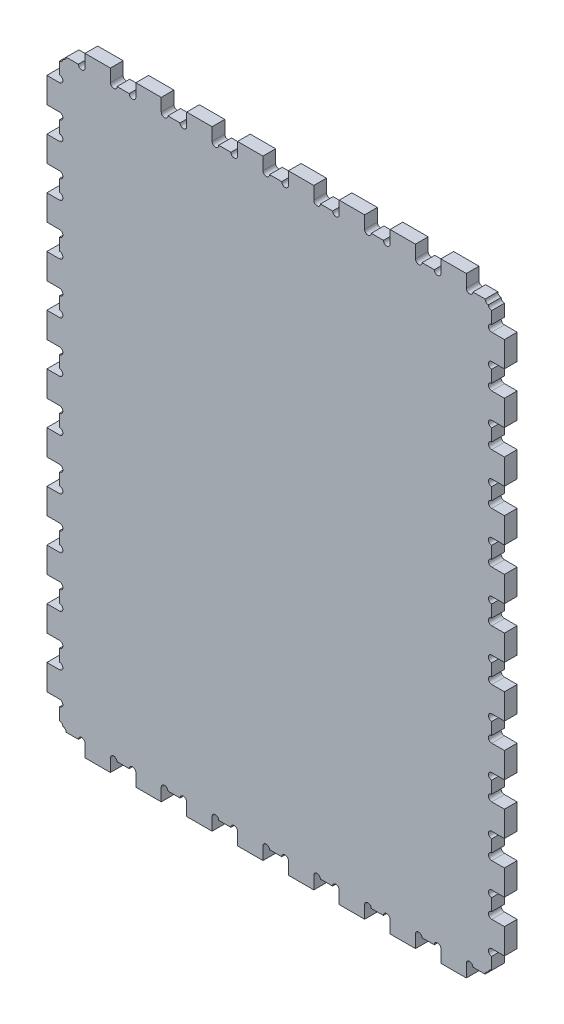
from build123d import *

# Parameters (mm, degrees)
SKETCH1_W               = 457.2
SKETCH1_H               = 609.6
BOSS_EXTRUDE1_DEPTH     = 12.7
CUT_EXTRUDE1_DEPTH      = 382.211607903
LPATTERN1_COUNT         = 9
LPATTERN1_PITCH         = 50.8
SKETCH6_W               = 12.7
SKETCH6_H               = 12.7
CUT_EXTRUDE4_DEPTH      = 382.211607903
CUT_EXTRUDE2_DEPTH      = 382.211607903
LPATTERN2_COUNT         = 12
LPATTERN2_PITCH         = 50.8
MIRROR7_COPY_1_SKETCH_W = 12.7
MIRROR7_COPY_1_SKETCH_H = 12.7
MIRROR7_COPY_1_DEPTH    = 382.211607903
MIRROR1_COPY_1_DEPTH    = 382.211607903
MIRROR1_COPY_2_DEPTH    = 382.211607903
MIRROR1_COPY_3_DEPTH    = 382.211607903
MIRROR1_COPY_4_DEPTH    = 382.211607903
MIRROR1_COPY_5_DEPTH    = 382.211607903
MIRROR1_COPY_6_DEPTH    = 382.211607903
MIRROR1_COPY_7_DEPTH    = 382.211607903
MIRROR1_COPY_8_DEPTH    = 382.211607903
MIRROR1_COPY_9_DEPTH    = 382.211607903
MIRROR1_COPY_10_DEPTH   = 382.211607903
MIRROR1_COPY_11_DEPTH   = 382.211607903
MIRROR1_COPY_12_DEPTH   = 382.211607903
MIRROR2_COPY_1_DEPTH    = 382.211607903
MIRROR2_COPY_2_DEPTH    = 382.211607903
MIRROR2_COPY_3_DEPTH    = 382.211607903
MIRROR2_COPY_4_DEPTH    = 382.211607903
MIRROR2_COPY_5_DEPTH    = 382.211607903
MIRROR2_COPY_6_DEPTH    = 382.211607903
MIRROR2_COPY_7_DEPTH    = 382.211607903
MIRROR2_COPY_8_DEPTH    = 382.211607903
MIRROR2_COPY_9_DEPTH    = 382.211607903


with BuildPart() as part:
    # Sketch1 → Boss-Extrude1 (new body)
    with BuildSketch(Plane.XY):
        Rectangle(SKETCH1_W, SKETCH1_H)
    extrude(amount=BOSS_EXTRUDE1_DEPTH)

    # Sketch2 → Cut-Extrude1 (cut, through all)
    with BuildSketch(Plane.XY.offset(12.7)):
        with BuildLine():
            Line((-190.5, 304.8), (-215.9, 304.8))
            Line((-215.9, 304.8), (-215.9, 292.1))
            ThreePointArc((-215.9, 292.1), (-212.598, 288.798), (-209.296, 292.1))
            Line((-209.296, 292.1), (-197.104, 292.1))
            ThreePointArc((-197.104, 292.1), (-193.802, 288.798), (-190.5, 292.1))
            Line((-190.5, 292.1), (-190.5, 304.8))
        make_face()
    cut_extrude1 = extrude(amount=-CUT_EXTRUDE1_DEPTH, mode=Mode.SUBTRACT)

    # LPattern1: Cut-Extrude1 ×9
    with Locations(*[(i * LPATTERN1_PITCH, 0, 0) for i in range(1, LPATTERN1_COUNT)]):
        add(cut_extrude1, mode=Mode.SUBTRACT)

    # Sketch6 → Cut-Extrude4 (cut, through all)
    with BuildSketch(Plane.XY.offset(12.7)):
        with Locations((-222.25, 298.45)):
            Rectangle(SKETCH6_W, SKETCH6_H)
    cut_extrude4 = extrude(amount=-CUT_EXTRUDE4_DEPTH, mode=Mode.SUBTRACT)

    # Sketch3 → Cut-Extrude2 (cut, through all)
    with BuildSketch(Plane.XY.offset(12.7)):
        with BuildLine():
            Line((-215.9, 292.1), (-228.6, 292.1))
            Line((-228.6, 292.1), (-228.6, 266.7))
            Line((-228.6, 266.7), (-215.9, 266.7))
            ThreePointArc((-215.9, 266.7), (-212.598, 270.002), (-215.9, 273.304))
            Line((-215.9, 273.304), (-215.9, 285.496))
            ThreePointArc((-215.9, 285.496), (-212.598, 288.798), (-215.9, 292.1))
        make_face()
    cut_extrude2 = extrude(amount=-CUT_EXTRUDE2_DEPTH, mode=Mode.SUBTRACT)

    # LPattern2: Cut-Extrude2 ×12
    with Locations(*[(0, -i * LPATTERN2_PITCH, 0) for i in range(1, LPATTERN2_COUNT)]):
        add(cut_extrude2, mode=Mode.SUBTRACT)

    # Mirror6: Cut-Extrude4 across plane
    add(cut_extrude4.mirror(Plane(origin=(0, 0, 0), x_dir=(0, 0, 1), z_dir=(1, 0, 0))), mode=Mode.SUBTRACT)

    # Mirror7: Cut-Extrude4 across plane
    add(cut_extrude4.mirror(Plane.ZX), mode=Mode.SUBTRACT)

    # Mirror7 copy 1 sketch → Mirror7 copy 1 (cut, through all)
    with BuildSketch(Plane(origin=(0, 0, 12.7), x_dir=(-1, 0, 0), z_dir=(0, 0, 1))):
        with Locations((-222.25, 298.45)):
            Rectangle(MIRROR7_COPY_1_SKETCH_W, MIRROR7_COPY_1_SKETCH_H)
    extrude(amount=-MIRROR7_COPY_1_DEPTH, mode=Mode.SUBTRACT)

    # Mirror1 copy 1 sketch → Mirror1 copy 1 (cut, through all)
    with BuildSketch(Plane(origin=(0, -50.8, 12.7), x_dir=(-1, 0, 0), z_dir=(0, 0, 1))):
        with BuildLine():
            Line((-215.9, -292.1), (-228.6, -292.1))
            Line((-228.6, -292.1), (-228.6, -266.7))
            Line((-228.6, -266.7), (-215.9, -266.7))
            ThreePointArc((-215.9, -266.7), (-212.598, -270.002), (-215.9, -273.304))
            Line((-215.9, -273.304), (-215.9, -285.496))
            ThreePointArc((-215.9, -285.496), (-212.598, -288.798), (-215.9, -292.1))
        make_face()
    extrude(amount=-MIRROR1_COPY_1_DEPTH, mode=Mode.SUBTRACT)

    # Mirror1 copy 2 sketch → Mirror1 copy 2 (cut, through all)
    with BuildSketch(Plane(origin=(0, -101.6, 12.7), x_dir=(-1, 0, 0), z_dir=(0, 0, 1))):
        with BuildLine():
            Line((-215.9, -292.1), (-228.6, -292.1))
            Line((-228.6, -292.1), (-228.6, -266.7))
            Line((-228.6, -266.7), (-215.9, -266.7))
            ThreePointArc((-215.9, -266.7), (-212.598, -270.002), (-215.9, -273.304))
            Line((-215.9, -273.304), (-215.9, -285.496))
            ThreePointArc((-215.9, -285.496), (-212.598, -288.798), (-215.9, -292.1))
        make_face()
    extrude(amount=-MIRROR1_COPY_2_DEPTH, mode=Mode.SUBTRACT)

    # Mirror1 copy 3 sketch → Mirror1 copy 3 (cut, through all)
    with BuildSketch(Plane(origin=(0, -152.4, 12.7), x_dir=(-1, 0, 0), z_dir=(0, 0, 1))):
        with BuildLine():
            Line((-215.9, -292.1), (-228.6, -292.1))
            Line((-228.6, -292.1), (-228.6, -266.7))
            Line((-228.6, -266.7), (-215.9, -266.7))
            ThreePointArc((-215.9, -266.7), (-212.598, -270.002), (-215.9, -273.304))
            Line((-215.9, -273.304), (-215.9, -285.496))
            ThreePointArc((-215.9, -285.496), (-212.598, -288.798), (-215.9, -292.1))
        make_face()
    extrude(amount=-MIRROR1_COPY_3_DEPTH, mode=Mode.SUBTRACT)

    # Mirror1 copy 4 sketch → Mirror1 copy 4 (cut, through all)
    with BuildSketch(Plane(origin=(0, -203.2, 12.7), x_dir=(-1, 0, 0), z_dir=(0, 0, 1))):
        with BuildLine():
            Line((-215.9, -292.1), (-228.6, -292.1))
            Line((-228.6, -292.1), (-228.6, -266.7))
            Line((-228.6, -266.7), (-215.9, -266.7))
            ThreePointArc((-215.9, -266.7), (-212.598, -270.002), (-215.9, -273.304))
            Line((-215.9, -273.304), (-215.9, -285.496))
            ThreePointArc((-215.9, -285.496), (-212.598, -288.798), (-215.9, -292.1))
        make_face()
    extrude(amount=-MIRROR1_COPY_4_DEPTH, mode=Mode.SUBTRACT)

    # Mirror1 copy 5 sketch → Mirror1 copy 5 (cut, through all)
    with BuildSketch(Plane(origin=(0, -254, 12.7), x_dir=(-1, 0, 0), z_dir=(0, 0, 1))):
        with BuildLine():
            Line((-215.9, -292.1), (-228.6, -292.1))
            Line((-228.6, -292.1), (-228.6, -266.7))
            Line((-228.6, -266.7), (-215.9, -266.7))
            ThreePointArc((-215.9, -266.7), (-212.598, -270.002), (-215.9, -273.304))
            Line((-215.9, -273.304), (-215.9, -285.496))
            ThreePointArc((-215.9, -285.496), (-212.598, -288.798), (-215.9, -292.1))
        make_face()
    extrude(amount=-MIRROR1_COPY_5_DEPTH, mode=Mode.SUBTRACT)

    # Mirror1 copy 6 sketch → Mirror1 copy 6 (cut, through all)
    with BuildSketch(Plane(origin=(0, -304.8, 12.7), x_dir=(-1, 0, 0), z_dir=(0, 0, 1))):
        with BuildLine():
            Line((-215.9, -292.1), (-228.6, -292.1))
            Line((-228.6, -292.1), (-228.6, -266.7))
            Line((-228.6, -266.7), (-215.9, -266.7))
            ThreePointArc((-215.9, -266.7), (-212.598, -270.002), (-215.9, -273.304))
            Line((-215.9, -273.304), (-215.9, -285.496))
            ThreePointArc((-215.9, -285.496), (-212.598, -288.798), (-215.9, -292.1))
        make_face()
    extrude(amount=-MIRROR1_COPY_6_DEPTH, mode=Mode.SUBTRACT)

    # Mirror1 copy 7 sketch → Mirror1 copy 7 (cut, through all)
    with BuildSketch(Plane(origin=(0, -355.6, 12.7), x_dir=(-1, 0, 0), z_dir=(0, 0, 1))):
        with BuildLine():
            Line((-215.9, -292.1), (-228.6, -292.1))
            Line((-228.6, -292.1), (-228.6, -266.7))
            Line((-228.6, -266.7), (-215.9, -266.7))
            ThreePointArc((-215.9, -266.7), (-212.598, -270.002), (-215.9, -273.304))
            Line((-215.9, -273.304), (-215.9, -285.496))
            ThreePointArc((-215.9, -285.496), (-212.598, -288.798), (-215.9, -292.1))
        make_face()
    extrude(amount=-MIRROR1_COPY_7_DEPTH, mode=Mode.SUBTRACT)

    # Mirror1 copy 8 sketch → Mirror1 copy 8 (cut, through all)
    with BuildSketch(Plane(origin=(0, -406.4, 12.7), x_dir=(-1, 0, 0), z_dir=(0, 0, 1))):
        with BuildLine():
            Line((-215.9, -292.1), (-228.6, -292.1))
            Line((-228.6, -292.1), (-228.6, -266.7))
            Line((-228.6, -266.7), (-215.9, -266.7))
            ThreePointArc((-215.9, -266.7), (-212.598, -270.002), (-215.9, -273.304))
            Line((-215.9, -273.304), (-215.9, -285.496))
            ThreePointArc((-215.9, -285.496), (-212.598, -288.798), (-215.9, -292.1))
        make_face()
    extrude(amount=-MIRROR1_COPY_8_DEPTH, mode=Mode.SUBTRACT)

    # Mirror1 copy 9 sketch → Mirror1 copy 9 (cut, through all)
    with BuildSketch(Plane(origin=(0, -457.2, 12.7), x_dir=(-1, 0, 0), z_dir=(0, 0, 1))):
        with BuildLine():
            Line((-215.9, -292.1), (-228.6, -292.1))
            Line((-228.6, -292.1), (-228.6, -266.7))
            Line((-228.6, -266.7), (-215.9, -266.7))
            ThreePointArc((-215.9, -266.7), (-212.598, -270.002), (-215.9, -273.304))
            Line((-215.9, -273.304), (-215.9, -285.496))
            ThreePointArc((-215.9, -285.496), (-212.598, -288.798), (-215.9, -292.1))
        make_face()
    extrude(amount=-MIRROR1_COPY_9_DEPTH, mode=Mode.SUBTRACT)

    # Mirror1 copy 10 sketch → Mirror1 copy 10 (cut, through all)
    with BuildSketch(Plane(origin=(0, -508, 12.7), x_dir=(-1, 0, 0), z_dir=(0, 0, 1))):
        with BuildLine():
            Line((-215.9, -292.1), (-228.6, -292.1))
            Line((-228.6, -292.1), (-228.6, -266.7))
            Line((-228.6, -266.7), (-215.9, -266.7))
            ThreePointArc((-215.9, -266.7), (-212.598, -270.002), (-215.9, -273.304))
            Line((-215.9, -273.304), (-215.9, -285.496))
            ThreePointArc((-215.9, -285.496), (-212.598, -288.798), (-215.9, -292.1))
        make_face()
    extrude(amount=-MIRROR1_COPY_10_DEPTH, mode=Mode.SUBTRACT)

    # Mirror1 copy 11 sketch → Mirror1 copy 11 (cut, through all)
    with BuildSketch(Plane(origin=(0, -558.8, 12.7), x_dir=(-1, 0, 0), z_dir=(0, 0, 1))):
        with BuildLine():
            Line((-215.9, -292.1), (-228.6, -292.1))
            Line((-228.6, -292.1), (-228.6, -266.7))
            Line((-228.6, -266.7), (-215.9, -266.7))
            ThreePointArc((-215.9, -266.7), (-212.598, -270.002), (-215.9, -273.304))
            Line((-215.9, -273.304), (-215.9, -285.496))
            ThreePointArc((-215.9, -285.496), (-212.598, -288.798), (-215.9, -292.1))
        make_face()
    extrude(amount=-MIRROR1_COPY_11_DEPTH, mode=Mode.SUBTRACT)

    # Mirror1 copy 12 sketch → Mirror1 copy 12 (cut, through all)
    with BuildSketch(Plane(origin=(0, 0, 12.7), x_dir=(-1, 0, 0), z_dir=(0, 0, 1))):
        with BuildLine():
            Line((-215.9, -292.1), (-228.6, -292.1))
            Line((-228.6, -292.1), (-228.6, -266.7))
            Line((-228.6, -266.7), (-215.9, -266.7))
            ThreePointArc((-215.9, -266.7), (-212.598, -270.002), (-215.9, -273.304))
            Line((-215.9, -273.304), (-215.9, -285.496))
            ThreePointArc((-215.9, -285.496), (-212.598, -288.798), (-215.9, -292.1))
        make_face()
    extrude(amount=-MIRROR1_COPY_12_DEPTH, mode=Mode.SUBTRACT)

    # Mirror2 copy 1 sketch → Mirror2 copy 1 (cut, through all)
    with BuildSketch(Plane(origin=(50.8, 0, 12.7), x_dir=(1, 0, 0), z_dir=(0, 0, 1))):
        with BuildLine():
            Line((-190.5, -304.8), (-215.9, -304.8))
            Line((-215.9, -304.8), (-215.9, -292.1))
            ThreePointArc((-215.9, -292.1), (-212.598, -288.798), (-209.296, -292.1))
            Line((-209.296, -292.1), (-197.104, -292.1))
            ThreePointArc((-197.104, -292.1), (-193.802, -288.798), (-190.5, -292.1))
            Line((-190.5, -292.1), (-190.5, -304.8))
        make_face()
    extrude(amount=-MIRROR2_COPY_1_DEPTH, mode=Mode.SUBTRACT)

    # Mirror2 copy 2 sketch → Mirror2 copy 2 (cut, through all)
    with BuildSketch(Plane(origin=(101.6, 0, 12.7), x_dir=(1, 0, 0), z_dir=(0, 0, 1))):
        with BuildLine():
            Line((-190.5, -304.8), (-215.9, -304.8))
            Line((-215.9, -304.8), (-215.9, -292.1))
            ThreePointArc((-215.9, -292.1), (-212.598, -288.798), (-209.296, -292.1))
            Line((-209.296, -292.1), (-197.104, -292.1))
            ThreePointArc((-197.104, -292.1), (-193.802, -288.798), (-190.5, -292.1))
            Line((-190.5, -292.1), (-190.5, -304.8))
        make_face()
    extrude(amount=-MIRROR2_COPY_2_DEPTH, mode=Mode.SUBTRACT)

    # Mirror2 copy 3 sketch → Mirror2 copy 3 (cut, through all)
    with BuildSketch(Plane(origin=(152.4, 0, 12.7), x_dir=(1, 0, 0), z_dir=(0, 0, 1))):
        with BuildLine():
            Line((-190.5, -304.8), (-215.9, -304.8))
            Line((-215.9, -304.8), (-215.9, -292.1))
            ThreePointArc((-215.9, -292.1), (-212.598, -288.798), (-209.296, -292.1))
            Line((-209.296, -292.1), (-197.104, -292.1))
            ThreePointArc((-197.104, -292.1), (-193.802, -288.798), (-190.5, -292.1))
            Line((-190.5, -292.1), (-190.5, -304.8))
        make_face()
    extrude(amount=-MIRROR2_COPY_3_DEPTH, mode=Mode.SUBTRACT)

    # Mirror2 copy 4 sketch → Mirror2 copy 4 (cut, through all)
    with BuildSketch(Plane(origin=(203.2, 0, 12.7), x_dir=(1, 0, 0), z_dir=(0, 0, 1))):
        with BuildLine():
            Line((-190.5, -304.8), (-215.9, -304.8))
            Line((-215.9, -304.8), (-215.9, -292.1))
            ThreePointArc((-215.9, -292.1), (-212.598, -288.798), (-209.296, -292.1))
            Line((-209.296, -292.1), (-197.104, -292.1))
            ThreePointArc((-197.104, -292.1), (-193.802, -288.798), (-190.5, -292.1))
            Line((-190.5, -292.1), (-190.5, -304.8))
        make_face()
    extrude(amount=-MIRROR2_COPY_4_DEPTH, mode=Mode.SUBTRACT)

    # Mirror2 copy 5 sketch → Mirror2 copy 5 (cut, through all)
    with BuildSketch(Plane(origin=(254, 0, 12.7), x_dir=(1, 0, 0), z_dir=(0, 0, 1))):
        with BuildLine():
            Line((-190.5, -304.8), (-215.9, -304.8))
            Line((-215.9, -304.8), (-215.9, -292.1))
            ThreePointArc((-215.9, -292.1), (-212.598, -288.798), (-209.296, -292.1))
            Line((-209.296, -292.1), (-197.104, -292.1))
            ThreePointArc((-197.104, -292.1), (-193.802, -288.798), (-190.5, -292.1))
            Line((-190.5, -292.1), (-190.5, -304.8))
        make_face()
    extrude(amount=-MIRROR2_COPY_5_DEPTH, mode=Mode.SUBTRACT)

    # Mirror2 copy 6 sketch → Mirror2 copy 6 (cut, through all)
    with BuildSketch(Plane(origin=(304.8, 0, 12.7), x_dir=(1, 0, 0), z_dir=(0, 0, 1))):
        with BuildLine():
            Line((-190.5, -304.8), (-215.9, -304.8))
            Line((-215.9, -304.8), (-215.9, -292.1))
            ThreePointArc((-215.9, -292.1), (-212.598, -288.798), (-209.296, -292.1))
            Line((-209.296, -292.1), (-197.104, -292.1))
            ThreePointArc((-197.104, -292.1), (-193.802, -288.798), (-190.5, -292.1))
            Line((-190.5, -292.1), (-190.5, -304.8))
        make_face()
    extrude(amount=-MIRROR2_COPY_6_DEPTH, mode=Mode.SUBTRACT)

    # Mirror2 copy 7 sketch → Mirror2 copy 7 (cut, through all)
    with BuildSketch(Plane(origin=(355.6, 0, 12.7), x_dir=(1, 0, 0), z_dir=(0, 0, 1))):
        with BuildLine():
            Line((-190.5, -304.8), (-215.9, -304.8))
            Line((-215.9, -304.8), (-215.9, -292.1))
            ThreePointArc((-215.9, -292.1), (-212.598, -288.798), (-209.296, -292.1))
            Line((-209.296, -292.1), (-197.104, -292.1))
            ThreePointArc((-197.104, -292.1), (-193.802, -288.798), (-190.5, -292.1))
            Line((-190.5, -292.1), (-190.5, -304.8))
        make_face()
    extrude(amount=-MIRROR2_COPY_7_DEPTH, mode=Mode.SUBTRACT)

    # Mirror2 copy 8 sketch → Mirror2 copy 8 (cut, through all)
    with BuildSketch(Plane(origin=(406.4, 0, 12.7), x_dir=(1, 0, 0), z_dir=(0, 0, 1))):
        with BuildLine():
            Line((-190.5, -304.8), (-215.9, -304.8))
            Line((-215.9, -304.8), (-215.9, -292.1))
            ThreePointArc((-215.9, -292.1), (-212.598, -288.798), (-209.296, -292.1))
            Line((-209.296, -292.1), (-197.104, -292.1))
            ThreePointArc((-197.104, -292.1), (-193.802, -288.798), (-190.5, -292.1))
            Line((-190.5, -292.1), (-190.5, -304.8))
        make_face()
    extrude(amount=-MIRROR2_COPY_8_DEPTH, mode=Mode.SUBTRACT)

    # Mirror2 copy 9 sketch → Mirror2 copy 9 (cut, through all)
    with BuildSketch(Plane.XY.offset(12.7)):
        with BuildLine():
            Line((-190.5, -304.8), (-215.9, -304.8))
            Line((-215.9, -304.8), (-215.9, -292.1))
            ThreePointArc((-215.9, -292.1), (-212.598, -288.798), (-209.296, -292.1))
            Line((-209.296, -292.1), (-197.104, -292.1))
            ThreePointArc((-197.104, -292.1), (-193.802, -288.798), (-190.5, -292.1))
            Line((-190.5, -292.1), (-190.5, -304.8))
        make_face()
    extrude(amount=-MIRROR2_COPY_9_DEPTH, mode=Mode.SUBTRACT)


solid = part.part
